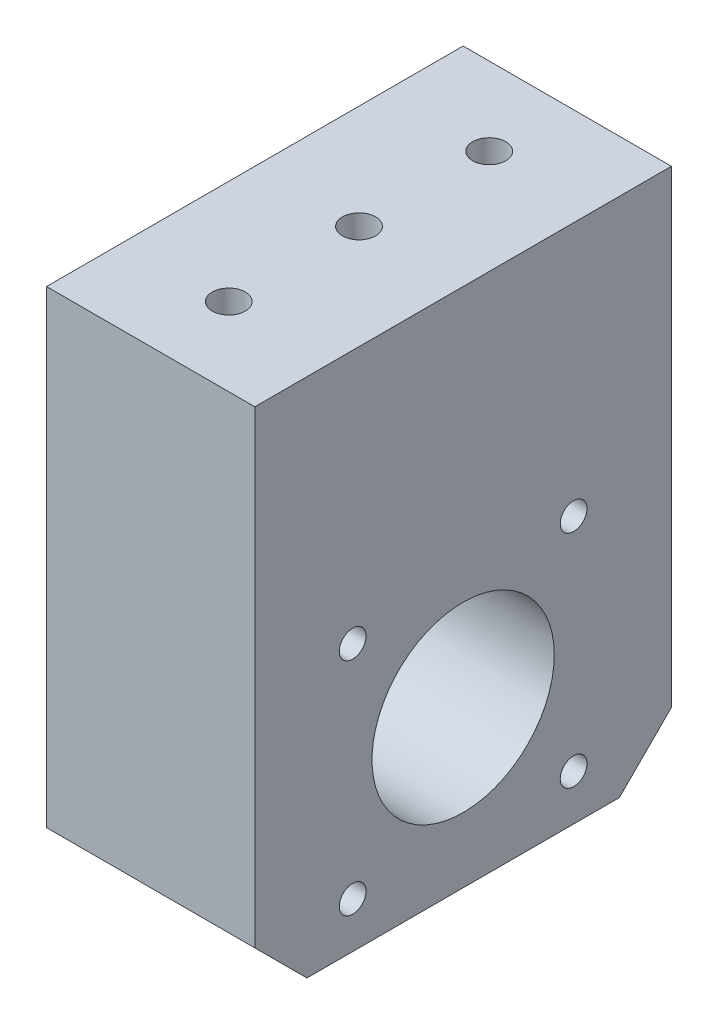
from build123d import *

# Parameters (mm, degrees)
SKETCH1_W                                      = 50.8
SKETCH1_H                                      = 63.5
BASE_DEPTH                                     = 25.4
F_7_8_0_875_DIAMETER_HOLE1_D                   = 22.225
F_10_32_TAPPED_HOLE1_D                         = 4.0386
F_10_32_TAPPED_HOLE1_DEPTH                     = 25.4
F_10_32_TAPPED_HOLE1_TIP                       = 1.213317848
CBORE_FOR_4_SOCKET_HEAD_CAP_SCREW1_D           = 3.2639
CBORE_FOR_4_SOCKET_HEAD_CAP_SCREW1_CBORE_D     = 5.55752
CBORE_FOR_4_SOCKET_HEAD_CAP_SCREW1_CBORE_DEPTH = 2.8448
CIRPATTERN1_COUNT                              = 4
CHAMFER2_SIZE                                  = 6.35


with BuildPart() as part:
    # Sketch1 → Base (new body)
    with BuildSketch(Plane(origin=(0, 0, 0), x_dir=(0, 0, -1), z_dir=(1, 0, 0))):
        Rectangle(SKETCH1_W, SKETCH1_H)
    extrude(amount=BASE_DEPTH)

    # 7/8 (0.875) Diameter Hole1 (through all)
    with Locations(Plane(origin=(25.4, 0, 0), x_dir=(0, 0, -1), z_dir=(1, 0, 0))):
        with Locations((0, -12.7)):
            Hole(F_7_8_0_875_DIAMETER_HOLE1_D / 2)

    # #10-32 Tapped Hole1
    with Locations(Plane(origin=(0, 31.75, 0), x_dir=(1, 0, 0), z_dir=(0, 1, 0))):
        with Locations((12.7, 15.875), (12.7, -15.875), (12.7, 0)):
            Hole(F_10_32_TAPPED_HOLE1_D / 2, depth=F_10_32_TAPPED_HOLE1_DEPTH)
            with Locations((0, 0, -(F_10_32_TAPPED_HOLE1_DEPTH + F_10_32_TAPPED_HOLE1_TIP / 2))):  # 118° drill point
                Cone(0, F_10_32_TAPPED_HOLE1_D / 2, F_10_32_TAPPED_HOLE1_TIP, mode=Mode.SUBTRACT)

    # CBORE for #4 Socket Head Cap Screw1 (through all)
    with Locations(Plane.ZY):
        with Locations((-13.470384182, 0.770384182)):
            cbore_for_4_socket_head_cap_screw1 = CounterBoreHole(CBORE_FOR_4_SOCKET_HEAD_CAP_SCREW1_D / 2, CBORE_FOR_4_SOCKET_HEAD_CAP_SCREW1_CBORE_D / 2, CBORE_FOR_4_SOCKET_HEAD_CAP_SCREW1_CBORE_DEPTH)

    # CirPattern1: CBORE for #4 Socket Head Cap Screw1 ×4 about axis
    cirpattern1_axis = Axis((0, -12.7, 0), (1, 0, 0))
    for i in range(1, CIRPATTERN1_COUNT):
        add(cbore_for_4_socket_head_cap_screw1.rotate(cirpattern1_axis, i * 360 / CIRPATTERN1_COUNT), mode=Mode.SUBTRACT)

    # Chamfer2
    chamfer2_edges = [part.edges().sort_by_distance(p)[0] for p in [
        (12.7, -31.75, 25.4),
        (12.7, -31.75, -25.4),
    ]]
    chamfer(chamfer2_edges, length=CHAMFER2_SIZE)


solid = part.part
